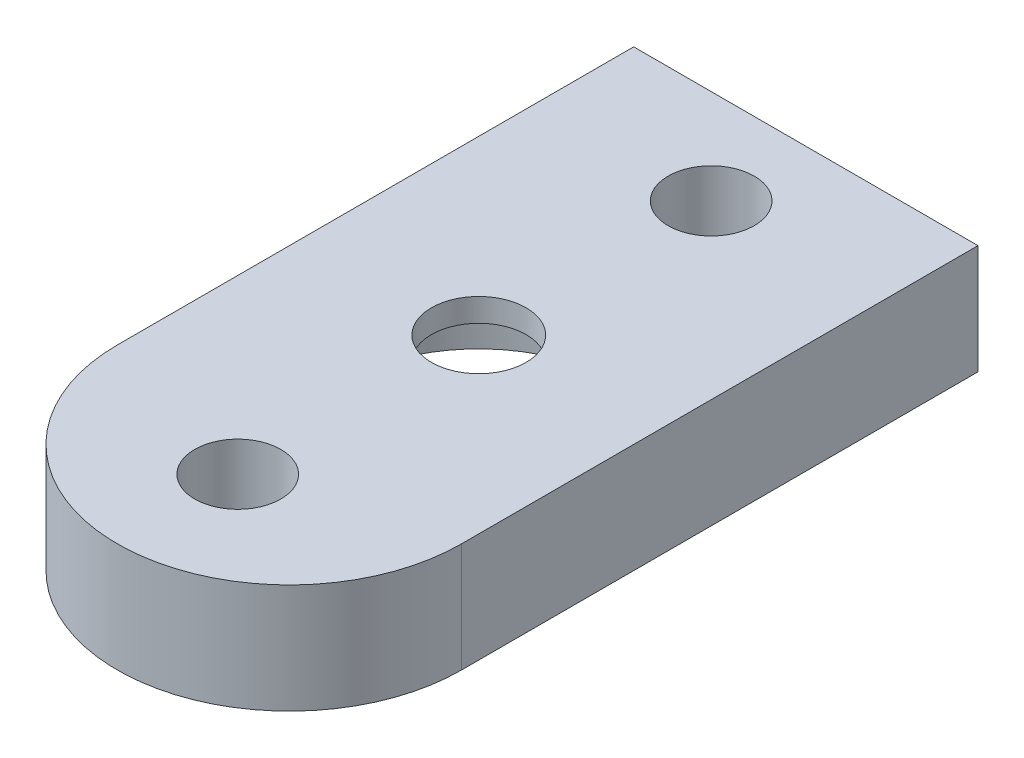
from build123d import *

# Parameters (mm, degrees)
BOSS_EXTRUDE1_DEPTH = 6.35
SKETCH2_R           = 8
CUT_EXTRUDE1_DEPTH  = 5
SKETCH3_R           = 2.75
CUT_EXTRUDE2_DEPTH  = 24.790754507
SKETCH4_R           = 2.5
CUT_EXTRUDE3_DEPTH  = 25.110630436


with BuildPart() as part:
    # Sketch1 → Boss-Extrude1 (new body)
    with BuildSketch(Plane(origin=(0, 0, 0), x_dir=(1, 0, 0), z_dir=(0, 1, 0))):
        with BuildLine():
            Line((-10, 19), (-10, -11))
            ThreePointArc((-10, -11), (0, -21), (10, -11))
            Line((10, -11), (10, 19))
            Line((10, 19), (-10, 19))
        make_face()
    extrude(amount=BOSS_EXTRUDE1_DEPTH)

    # Sketch2 → Cut-Extrude1 (cut)
    with BuildSketch(Plane.XZ):
        Circle(SKETCH2_R)
    extrude(amount=-CUT_EXTRUDE1_DEPTH, mode=Mode.SUBTRACT)

    # Sketch3 → Cut-Extrude2 (cut, through all)
    with BuildSketch(Plane.XZ.offset(-5)):
        Circle(SKETCH3_R)
    extrude(amount=-CUT_EXTRUDE2_DEPTH, mode=Mode.SUBTRACT)

    # Sketch4 → Cut-Extrude3 (cut, through all)
    with BuildSketch(Plane.XZ):
        with Locations((0, 14)):
            Circle(SKETCH4_R)
        with Locations((0, -13.5)):
            Circle(SKETCH4_R)
    extrude(amount=-CUT_EXTRUDE3_DEPTH, mode=Mode.SUBTRACT)


solid = part.part
